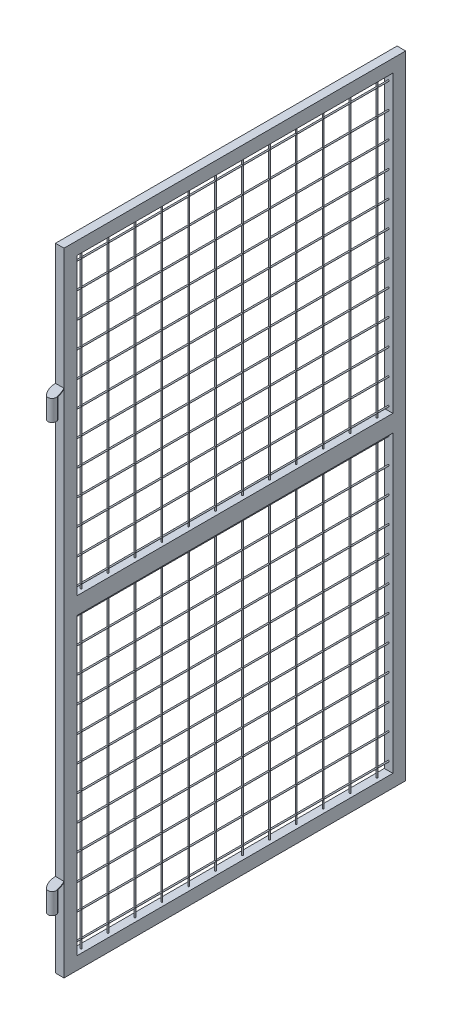
from build123d import *

# Parameters (mm, degrees)
SKETCH1_W           = 800
SKETCH1_H           = 1480
SKETCH1_W_2         = 740
SKETCH1_H_2         = 690
BOSS_EXTRUDE1_DEPTH = 20
BOSS_EXTRUDE2_DEPTH = 2
BOSS_EXTRUDE3_START = -47
BOSS_EXTRUDE3_DEPTH = 47
LPATTERN1_COUNT     = 2
LPATTERN1_PITCH     = 1000
SKETCH3_R           = 1.5
BOSS_EXTRUDE4_DEPTH = 752
LPATTERN2_COUNT     = 24
LPATTERN2_PITCH     = 60
SKETCH4_R           = 1.5
BOSS_EXTRUDE5_DEPTH = 1430
LPATTERN3_COUNT     = 12
LPATTERN3_PITCH     = 63


with BuildPart() as part:
    # Sketch1 → Boss-Extrude1 (new body)
    with BuildSketch(Plane(origin=(0, 0, 0), x_dir=(0, 0, -1), z_dir=(1, 0, 0))):
        with Locations((400, 740)):
            Rectangle(SKETCH1_W, SKETCH1_H)
        with Locations((400, 1105)):
            Rectangle(SKETCH1_W_2, SKETCH1_H_2, mode=Mode.SUBTRACT)
        with Locations((400, 375)):
            Rectangle(SKETCH1_W_2, SKETCH1_H_2, mode=Mode.SUBTRACT)
    extrude(amount=BOSS_EXTRUDE1_DEPTH)

    # Sketch2 → Boss-Extrude2 (add)
    with BuildSketch(Plane(origin=(0, 194, 0), x_dir=(1, 0, 0), z_dir=(0, 1, 0))):
        with BuildLine():
            Line((20, 0), (0, 0))
            ThreePointArc((0, 0), (3.481957283, -18.162565621), (12.827863363, -34.12053717))
            ThreePointArc((12.827863363, -34.12053717), (24.31906323, -36.509111613), (29.361099261, -25.910487414))
            ThreePointArc((29.361099261, -25.910487414), (25.490555801, -12.662599727), (20, 0))
        make_face()
    boss_extrude2 = extrude(amount=BOSS_EXTRUDE2_DEPTH)

    # Sketch2<3> → Boss-Extrude3 (add)
    with BuildSketch(Plane(origin=(0, 194, 0), x_dir=(1, 0, 0), z_dir=(0, 1, 0)).offset(BOSS_EXTRUDE3_START)):
        with BuildLine():
            ThreePointArc((29.361099261, -25.910487414), (15.868616478, -19.491768998), (12.827863363, -34.12053717))
            ThreePointArc((12.827863363, -34.12053717), (23.351386733, -36.924474614), (29.593839854, -28.000440306))
            ThreePointArc((29.593839854, -28.000440306), (29.535475421, -26.949004231), (29.361099261, -25.910487414))
        make_face()
    boss_extrude3 = extrude(amount=BOSS_EXTRUDE3_DEPTH)

    # LPattern1: Boss-Extrude2, Boss-Extrude3 ×2
    with Locations(*[(0, i * LPATTERN1_PITCH, 0) for i in range(1, LPATTERN1_COUNT)]):
        add(boss_extrude2)
        add(boss_extrude3)

    # Sketch3 → Boss-Extrude4 (add)
    with BuildSketch(Plane(origin=(0, 0, -30), x_dir=(-1, 0, 0), z_dir=(0, 0, -1))):
        with Locations((-10, 50)):
            Circle(SKETCH3_R)
    boss_extrude4 = extrude(amount=BOSS_EXTRUDE4_DEPTH)

    # LPattern2: Boss-Extrude4 ×24
    with Locations(*[(0, i * LPATTERN2_PITCH, 0) for i in range(1, LPATTERN2_COUNT)]):
        add(boss_extrude4)

    # Sketch4 → Boss-Extrude5 (add)
    with BuildSketch(Plane(origin=(0, 30, 0), x_dir=(1, 0, 0), z_dir=(0, 1, 0))):
        with Locations((10, 50)):
            Circle(SKETCH4_R)
    boss_extrude5 = extrude(amount=BOSS_EXTRUDE5_DEPTH)

    # LPattern3: Boss-Extrude5 ×12
    with Locations(*[(0, 0, -i * LPATTERN3_PITCH) for i in range(1, LPATTERN3_COUNT)]):
        add(boss_extrude5)


solid = part.part
